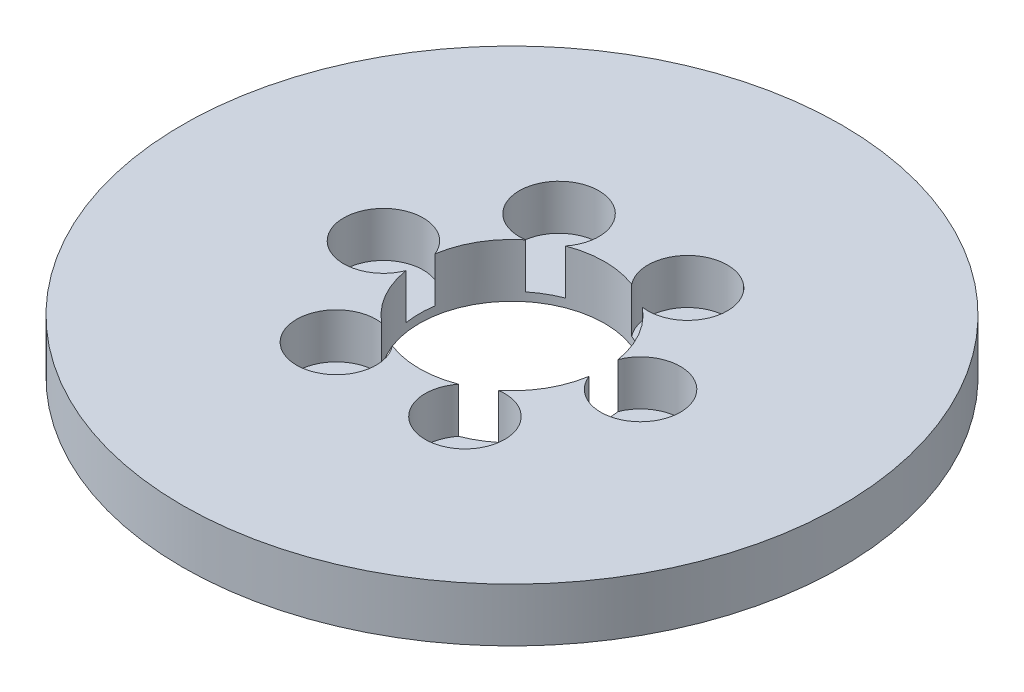
from build123d import *

# Parameters (mm, degrees)
SKETCH1_R           = 80
BOSS_EXTRUDE1_DEPTH = 13
SKETCH2_R           = 22.5
CUT_EXTRUDE1_DEPTH  = 114.881517377
SKETCH3_R           = 9.658035492
CUT_EXTRUDE2_DEPTH  = 10.949840141
CIRPATTERN1_COUNT   = 6


with BuildPart() as part:
    # Sketch1 → Boss-Extrude1 (new body)
    with BuildSketch(Plane(origin=(0, 0, 0), x_dir=(1, 0, 0), z_dir=(0, 1, 0))):
        Circle(SKETCH1_R)
    extrude(amount=BOSS_EXTRUDE1_DEPTH)

    # Sketch2 → Cut-Extrude1 (cut, through all)
    with BuildSketch(Plane(origin=(0, 0, 0), x_dir=(1, 0, 0), z_dir=(0, 1, 0))):
        Circle(SKETCH2_R)
    extrude(amount=CUT_EXTRUDE1_DEPTH, mode=Mode.SUBTRACT)

    # Sketch3 → Cut-Extrude2 (cut)
    with BuildSketch(Plane(origin=(0, 13, 0), x_dir=(1, 0, 0), z_dir=(0, 1, 0))):
        with Locations((-31.210100321, 0)):
            Circle(SKETCH3_R)
    cut_extrude2 = extrude(amount=-CUT_EXTRUDE2_DEPTH, mode=Mode.SUBTRACT)

    # CirPattern1: Cut-Extrude2 ×6 about axis
    cirpattern1_axis = Axis((0, 0, 0), (0, 1, 0))
    for i in range(1, CIRPATTERN1_COUNT):
        add(cut_extrude2.rotate(cirpattern1_axis, i * 360 / CIRPATTERN1_COUNT), mode=Mode.SUBTRACT)


solid = part.part
